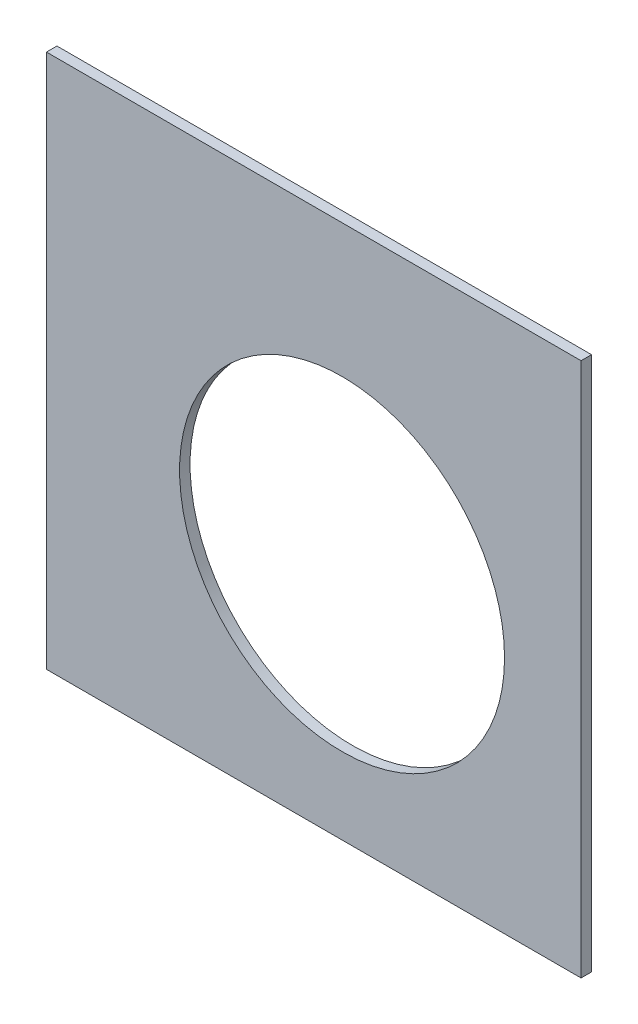
from build123d import *

# Parameters (mm, degrees)
SKETCH1_W           = 323.85
SKETCH1_H           = 323.85
SKETCH1_R           = 98.425
BOSS_EXTRUDE1_DEPTH = 6.35


with BuildPart() as part:
    # Sketch1 → Boss-Extrude1 (new body)
    with BuildSketch(Plane.XY):
        with Locations((161.925, 161.925)):
            Rectangle(SKETCH1_W, SKETCH1_H)
        with Locations((179.07, 144.78)):
            Circle(SKETCH1_R, mode=Mode.SUBTRACT)
    extrude(amount=BOSS_EXTRUDE1_DEPTH)


solid = part.part
